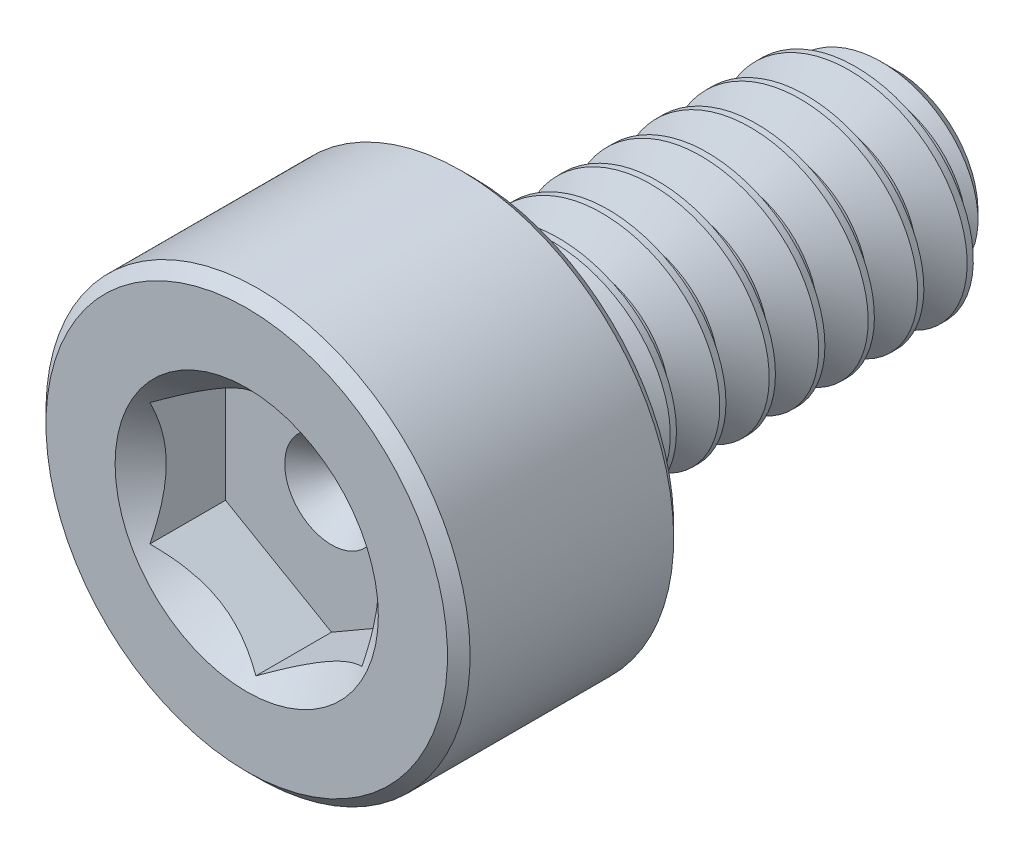
from build123d import *

# Parameters (mm, degrees)
CUT_EXTRUDE1_DEPTH     = 0.6
SKETCH4_R              = 0.930977309
CUT_EXTRUDE2_DEPTH     = 0.8
CUT_EXTRUDE2_DRAFT     = -45
SPLIT1_SURFACE_1_BACK  = 7.258
SPLIT1_SURFACE_1_DEPTH = 14.516
SPLIT1_SURFACE_2_BACK  = 7.258
SPLIT1_SURFACE_2_DEPTH = 14.516
CUT_SWEEP1_PITCH       = 0.35


with BuildPart() as part:
    # Sketch2 → Revolve1 (revolve)
    with BuildSketch(Plane(origin=(0, 0, 0), x_dir=(0, 0, -1), z_dir=(1, 0, 0))):
        with BuildLine():
            Line((-2.3, 0), (-2.3, 1.42))
            Line((-2.3, 1.42), (-2.22, 1.5))
            Line((-2.22, 1.5), (-0.78, 1.5))
            Line((-0.78, 1.5), (-0.7, 1.42))
            Line((-0.7, 1.42), (-0.7, 0.88))
            ThreePointArc((-0.7, 0.88), (-0.676568542, 0.823431458), (-0.62, 0.8))
            Line((-0.62, 0.8), (2.072668332, 0.8))
            Line((2.072668332, 0.8), (2.3, 0.572668332))
            Line((2.3, 0.572668332), (2.3, 0))
            Line((2.3, 0), (-2.3, 0))
        make_face()
    revolve(axis=Axis((0, 0, -2.3), (0, 0, 1)))

    # Sketch3 → Cut-Extrude1 (cut)
    with BuildSketch(Plane.XY.offset(2.3)):
        Polygon((0.75, -0.433012702), (0.75, 0.433012702), (0, 0.866025404), (-0.75, 0.433012702), (-0.75, -0.433012702), (0, -0.866025404), align=None)
    extrude(amount=-CUT_EXTRUDE1_DEPTH, mode=Mode.SUBTRACT)


with BuildPart() as cut_extrude2_tool:
    # Sketch4 → Cut-Extrude2 (with draft: the straight prism first)
    with BuildSketch(Plane.XY.offset(2.3)):
        Circle(SKETCH4_R)
    extrude(amount=-CUT_EXTRUDE2_DEPTH)
    # Cut-Extrude2: the draft: its side faces are tilted about the plane it starts from
    cut_extrude2_sides = [cut_extrude2_tool.faces().sort_by_distance(p)[0] for p in [
        (-0.930977309, 0, 1.9),
    ]]
    draft(cut_extrude2_sides, Plane.XY.offset(2.3), CUT_EXTRUDE2_DRAFT)


with BuildPart() as part_1:
    add(part.part)

    # Cut-Extrude2: cut by cut_extrude2_tool
    add(cut_extrude2_tool.part, mode=Mode.SUBTRACT)


with BuildPart() as body_2:
    # Split1: the piece behind the surface
    add(part_1.part)
    # Split1 surface: a surface, the sketch's curves swept straight by 14.516 mm
    with BuildLine(Plane(origin=(0, 0, 0), x_dir=(0, 0, -1), z_dir=(1, 0, 0)).offset(-SPLIT1_SURFACE_1_BACK), mode=Mode.PRIVATE) as split1_surface_1_path:
        Line((-0.62, -1.5), (-0.62, 1.5))
    split1_surface_1 = Shell.extrude(split1_surface_1_path.wire(), (1 * SPLIT1_SURFACE_1_DEPTH, 0 * SPLIT1_SURFACE_1_DEPTH, 0 * SPLIT1_SURFACE_1_DEPTH))
    split(bisect_by=split1_surface_1, keep=Keep.BOTTOM)

    # Cut-Sweep1: the profile of Sketch7 screwed along a right-hand helix of 9.571429 turns, 6 arcs to a turn; built about Z, then put on its axis
    cut_sweep1_z = Axis((0, 0, 0), (0, 0, 1))
    cut_sweep1_corners = [(0.818944306, 0, 0.0109375), (0.818944306, 0, -0.3171875), (0.572668332, 0, -0.175), (0.572668332, 0, -0.13125)]
    with BuildLine(mode=Mode.PRIVATE) as cut_sweep1_profile:
        Line(cut_sweep1_corners[0], cut_sweep1_corners[1])
        Line(cut_sweep1_corners[1], cut_sweep1_corners[2])
        Line(cut_sweep1_corners[2], cut_sweep1_corners[3])
        Line(cut_sweep1_corners[3], cut_sweep1_corners[0])
    cut_sweep1_cap = Face(cut_sweep1_profile.wire())
    cut_sweep1_turn_angles = [0, 30, 60, 90, 120, 150, 180, 210, 240, 270, 300, 330, 360]
    cut_sweep1_turn_weights = [1, 0.8660254037844387, 1, 0.8660254037844387, 1, 0.8660254037844387, 1, 0.8660254037844387, 1, 0.8660254037844387, 1, 0.8660254037844387, 1]
    cut_sweep1_turn_rails = [Edge.make_bspline([Vector(p[0], p[1], 0).rotate(cut_sweep1_z, cut_sweep1_turn_angles[k]) / cut_sweep1_turn_weights[k] + Vector(0, 0, p[2] + CUT_SWEEP1_PITCH * cut_sweep1_turn_angles[k] / 360) for k in range(13)], [0, 0, 0, 1, 1, 2, 2, 3, 3, 4, 4, 5, 5, 6, 6, 6], 2, cut_sweep1_turn_weights) for p in cut_sweep1_corners]
    cut_sweep1_turn_sides = [Face.make_surface_from_curves(cut_sweep1_turn_rails[p[0]], cut_sweep1_turn_rails[p[1]]) for p in [(0, 1), (1, 2), (2, 3), (3, 0)]]
    cut_sweep1_last_angles = [3240, 3270, 3300, 3330, 3360, 3390, 3420, 3432.857142857, 3445.714285714]
    cut_sweep1_last_weights = [1, 0.8660254037844387, 1, 0.8660254037844387, 1, 0.8660254037844387, 1, 0.9749279121818499, 1]
    cut_sweep1_last_rails = [Edge.make_bspline([Vector(p[0], p[1], 0).rotate(cut_sweep1_z, cut_sweep1_last_angles[k]) / cut_sweep1_last_weights[k] + Vector(0, 0, p[2] + CUT_SWEEP1_PITCH * cut_sweep1_last_angles[k] / 360) for k in range(9)], [0, 0, 0, 1, 1, 2, 2, 3, 3, 4, 4, 4], 2, cut_sweep1_last_weights) for p in cut_sweep1_corners]
    cut_sweep1_last_sides = [Face.make_surface_from_curves(cut_sweep1_last_rails[p[0]], cut_sweep1_last_rails[p[1]]) for p in [(0, 1), (1, 2), (2, 3), (3, 0)]]
    cut_sweep1 = Plane(origin=(0, 0, -2.3), x_dir=(0, 1, 0), z_dir=(0, 0, 1)) * Solid(Shell([*[p.moved(Location((0, 0, CUT_SWEEP1_PITCH * i))) for i in range(9) for p in cut_sweep1_turn_sides], *cut_sweep1_last_sides, cut_sweep1_cap, cut_sweep1_cap.rotate(cut_sweep1_z, 3445.714285714).moved(Location((0, 0, CUT_SWEEP1_PITCH * 3445.714285714 / 360)))]))
    add(cut_sweep1, mode=Mode.SUBTRACT)


with BuildPart() as part_2:
    add(part_1.part)

    # Split1: split by a surface, the side it looks to stays
    # Split1 surface: a surface, the sketch's curves swept straight by 14.516 mm
    with BuildLine(Plane(origin=(0, 0, 0), x_dir=(0, 0, -1), z_dir=(1, 0, 0)).offset(-SPLIT1_SURFACE_2_BACK), mode=Mode.PRIVATE) as split1_surface_2_path:
        Line((-0.62, -1.5), (-0.62, 1.5))
    split1_surface_2 = Shell.extrude(split1_surface_2_path.wire(), (1 * SPLIT1_SURFACE_2_DEPTH, 0 * SPLIT1_SURFACE_2_DEPTH, 0 * SPLIT1_SURFACE_2_DEPTH))
    split(bisect_by=split1_surface_2, keep=Keep.TOP)

    add(body_2.part)  # Revolve2 merges body 2
    # Sketch8 → Revolve2 (revolve)
    with BuildSketch(Plane(origin=(0, 0, 0), x_dir=(0, 0, -1), z_dir=(1, 0, 0))):
        Polygon((-0.7, 0), (-0.7, 0.8), (-0.62, 0.8), (-0.158119785, 0), align=None)
    revolve(axis=Axis((0, 0, 0.158119785), (0, 0, 1)))


solid = part_2.part
